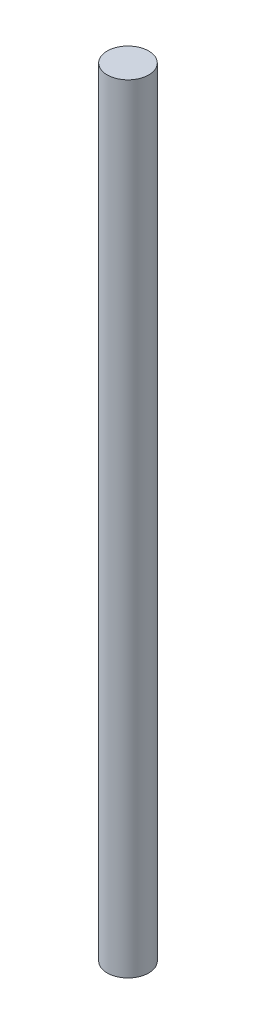
from build123d import *

# Parameters (mm, degrees)
SKETCH1_R           = 4
BOSS_EXTRUDE1_DEPTH = 150


with BuildPart() as part:
    # Sketch1 → Boss-Extrude1 (new body)
    with BuildSketch(Plane(origin=(0, 0, 0), x_dir=(1, 0, 0), z_dir=(0, 1, 0))):
        Circle(SKETCH1_R)
    extrude(amount=BOSS_EXTRUDE1_DEPTH)


solid = part.part
